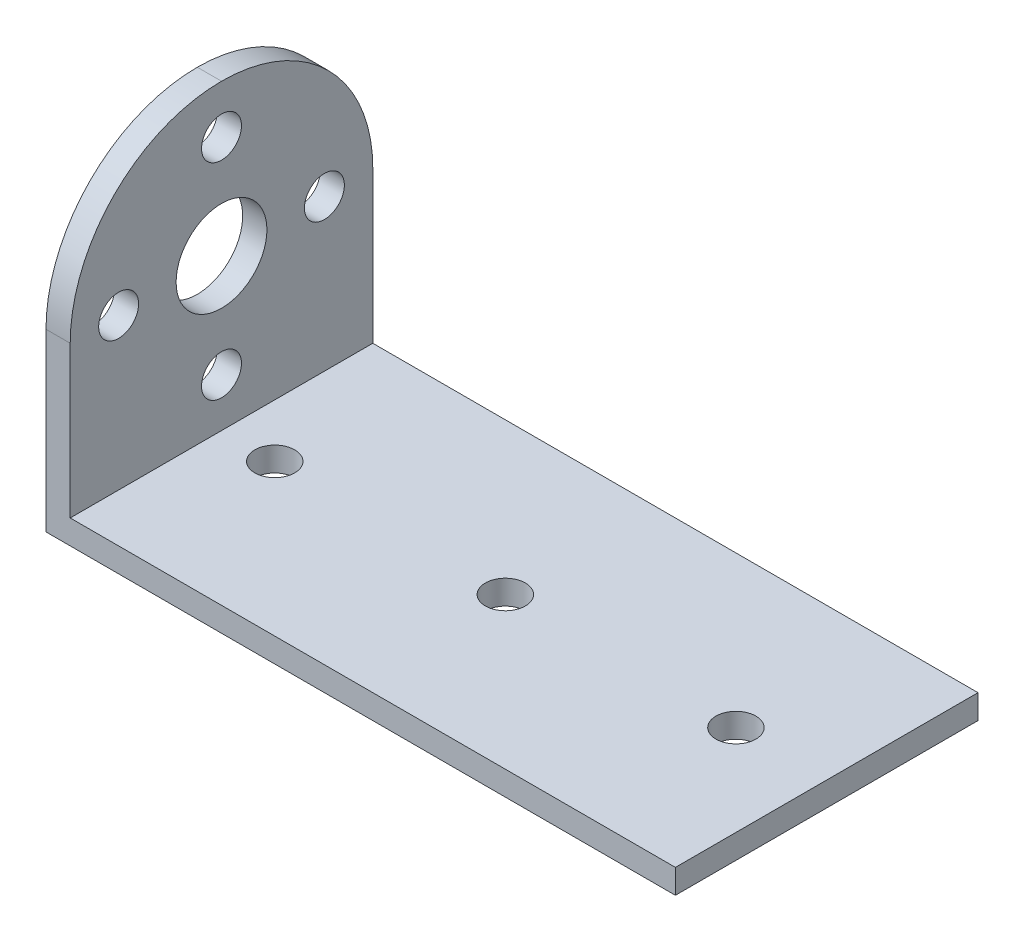
from build123d import *

# Parameters (mm, degrees)
P_IDAT_VYSUNUT_M1_DEPTH  = 25
SKICA2_R                 = 3.75
SKICA2_R_2               = 1.65
ODEBRAT_VYSUNUT_M2_DEPTH = 25
ZAOBLIT2_R               = 12.5
SKICA3_R                 = 1.65
ODEBRAT_VYSUNUT_M3_DEPTH = 10


with BuildPart() as part:
    # Skica1 → Přidat vysunutím1 (new body)
    with BuildSketch(Plane.XY):
        Polygon((0, 0), (0, 27), (2, 27), (2, 2), (52, 2), (52, 0), align=None)
    extrude(amount=P_IDAT_VYSUNUT_M1_DEPTH)

    # Skica2 → Odebrat vysunutím2 (cut)
    with BuildSketch(Plane.ZY):
        with Locations((12.5, 14.5)):
            Circle(SKICA2_R)
        with Locations((12.5, 23)):
            Circle(SKICA2_R_2)
        with Locations((21, 14.5)):
            Circle(SKICA2_R_2)
        with Locations((4, 14.5)):
            Circle(SKICA2_R_2)
        with Locations((12.5, 6)):
            Circle(SKICA2_R_2)
    extrude(amount=-ODEBRAT_VYSUNUT_M2_DEPTH, mode=Mode.SUBTRACT)

    # Zaoblit2
    zaoblit2_edges = [part.edges().sort_by_distance(p)[0] for p in [
        (1, 27, 0),
        (1, 27, 25),
    ]]
    fillet(zaoblit2_edges, radius=ZAOBLIT2_R - 0.0001)  # a hair under: the kernel refuses the full size

    # Skica3 → Odebrat vysunutím3 (cut)
    with BuildSketch(Plane.XZ):
        with Locations((6.4, 12.5)):
            Circle(SKICA3_R)
        with Locations((25.45, 12.5)):
            Circle(SKICA3_R)
        with Locations((44.5, 12.5)):
            Circle(SKICA3_R)
    extrude(amount=-ODEBRAT_VYSUNUT_M3_DEPTH, mode=Mode.SUBTRACT)


solid = part.part
